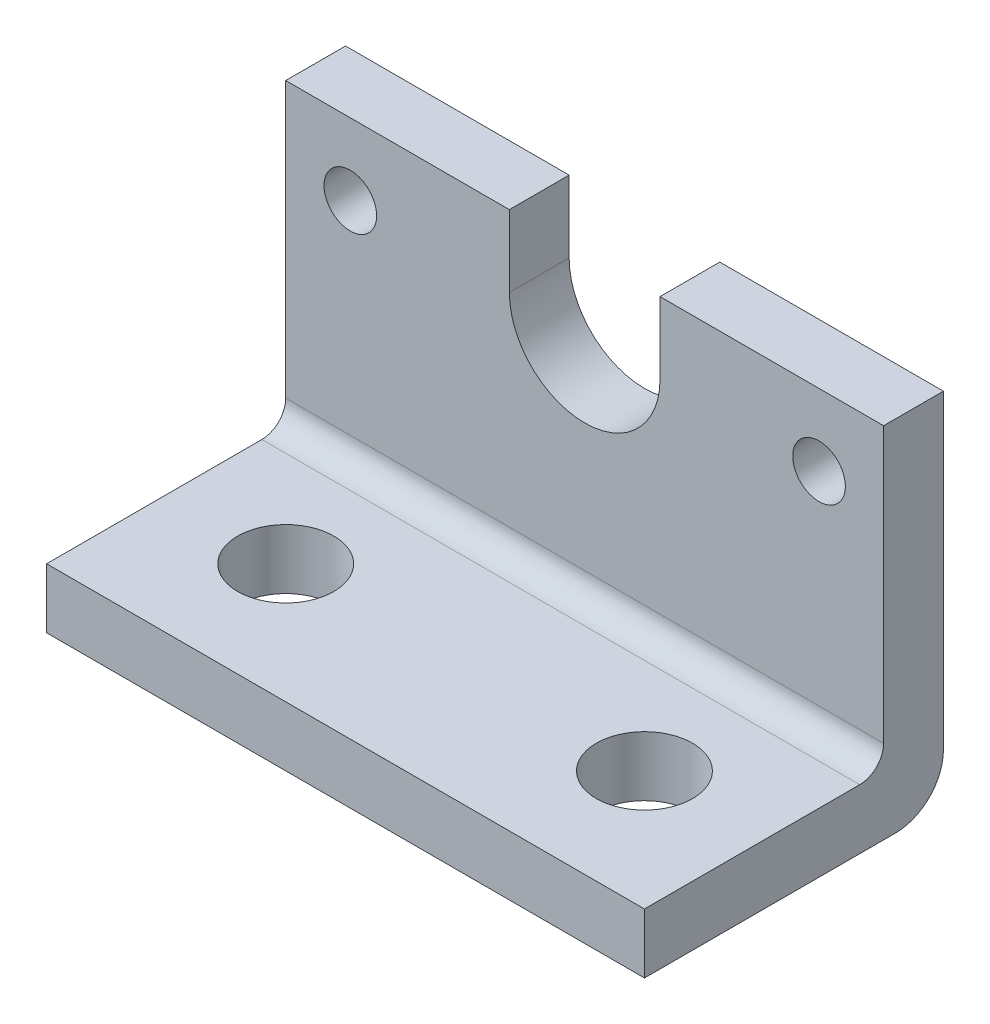
from build123d import *

# Parameters (mm, degrees)
SKETCH1_R           = 1.397
BOSS_EXTRUDE1_DEPTH = 3.175
SKETCH2_W           = 31.75
SKETCH2_H           = 12.7
SKETCH2_R           = 2.5527
BOSS_EXTRUDE2_DEPTH = 3.175
FILLET1_R           = 1.27
FILLET2_R           = 2.54


with BuildPart() as part:
    # Sketch1 → Boss-Extrude1 (new body)
    with BuildSketch(Plane.XY):
        with BuildLine():
            Line((-4.0005, 15.24), (-4.0005, 19.05))
            Line((-4.0005, 19.05), (-15.875, 19.05))
            Line((-15.875, 19.05), (-15.875, 0))
            Line((-15.875, 0), (15.875, 0))
            Line((15.875, 0), (15.875, 19.05))
            Line((15.875, 19.05), (4.0005, 19.05))
            Line((4.0005, 19.05), (4.0005, 15.24))
            ThreePointArc((4.0005, 15.24), (0, 11.2395), (-4.0005, 15.24))
        make_face()
        with Locations((12.446, 15.24)):
            Circle(SKETCH1_R, mode=Mode.SUBTRACT)
        with Locations((-12.446, 15.24)):
            Circle(SKETCH1_R, mode=Mode.SUBTRACT)
    extrude(amount=-BOSS_EXTRUDE1_DEPTH)

    # Sketch2 → Boss-Extrude2 (add)
    with BuildSketch(Plane(origin=(0, 0, 0), x_dir=(1, 0, 0), z_dir=(0, 1, 0))):
        with Locations((0, -6.35)):
            Rectangle(SKETCH2_W, SKETCH2_H)
        with Locations((-9.525, -6.35)):
            Circle(SKETCH2_R, mode=Mode.SUBTRACT)
        with Locations((9.525, -6.35)):
            Circle(SKETCH2_R, mode=Mode.SUBTRACT)
    extrude(amount=BOSS_EXTRUDE2_DEPTH)

    # Fillet1
    fillet1_edges = [part.edges().sort_by_distance(p)[0] for p in [
        (0, 3.175, 0),
    ]]
    fillet(fillet1_edges, radius=FILLET1_R)

    # Fillet2
    fillet2_edges = [part.edges().sort_by_distance(p)[0] for p in [
        (0, 0, -3.175),
    ]]
    fillet(fillet2_edges, radius=FILLET2_R)


solid = part.part
